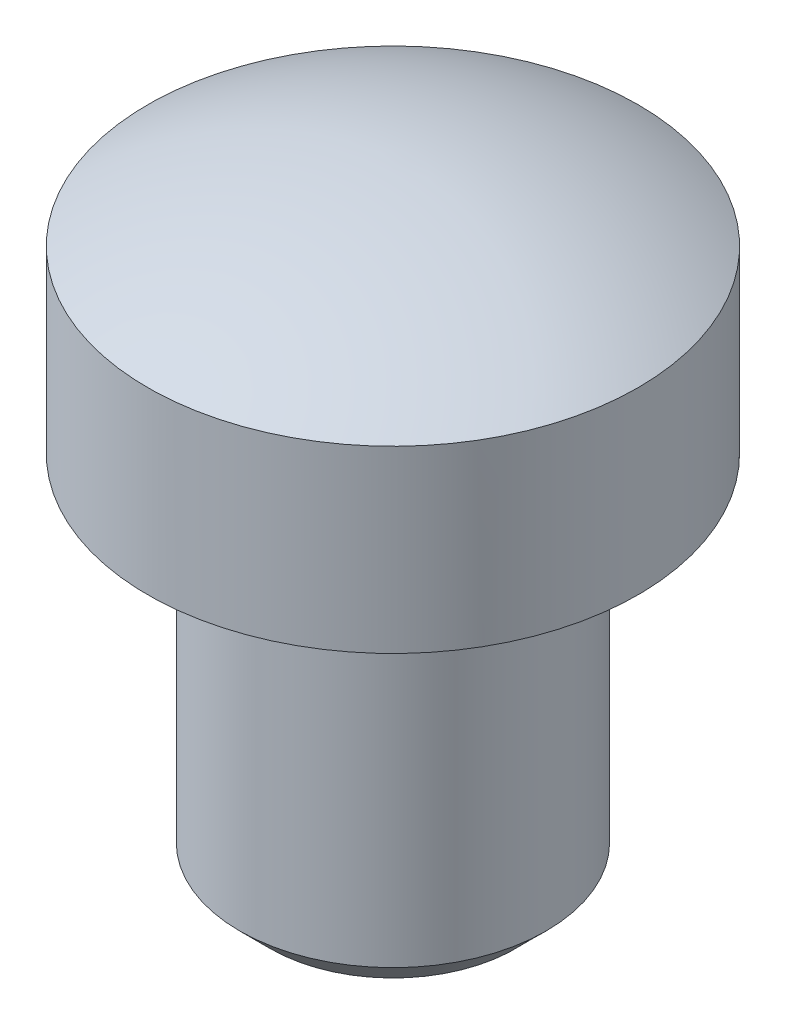
from build123d import *

# Parameters (mm, degrees)
CHAMFER_1_SIZE = 1


with BuildPart() as part:
    # 草图1 → 旋转1 (revolve)
    with BuildSketch(Plane.XY, mode=Mode.PRIVATE) as revolve_1_sk:
        with BuildLine():
            Line((8, -2.143593539), (8, -8))
            Line((8, -8), (4, -8))
            Line((4, -8), (4, -9))
            Line((4, -9), (5, -9))
            Line((5, -9), (5, -20))
            Line((5, -20), (0, -20))
            Line((0, -20), (0, 0))
            ThreePointArc((0, 0), (4.141104722, -0.545186779), (8, -2.143593539))
        make_face()
    revolve(revolve_1_sk.sketch.rotate(Axis((0, -20, 0), (0, 1, 0)), 90), axis=Axis((0, -20, 0), (0, 1, 0)))

    # 倒角1
    chamfer_1_edges = [part.edges().sort_by_distance(p)[0] for p in [
        (0, -9, 5),
        (0, -20, 5),
    ]]
    chamfer(chamfer_1_edges, length=CHAMFER_1_SIZE - 0.0001)  # a hair under: the kernel refuses the full size


solid = part.part
